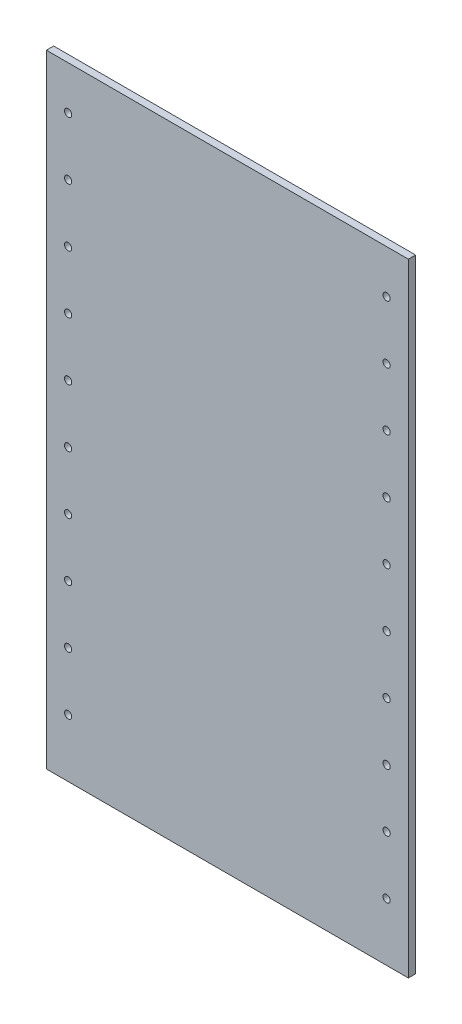
from build123d import *

# Parameters (mm, degrees)
SKETCH1_W           = 158.76
SKETCH1_H           = 273.05
SKETCH1_R           = 1.5875
BOSS_EXTRUDE1_DEPTH = 3.175


with BuildPart() as part:
    # Sketch1 → Boss-Extrude1 (new body)
    with BuildSketch(Plane.XY):
        with Locations((79.38, -136.525)):
            Rectangle(SKETCH1_W, SKETCH1_H)
        with Locations((9.53, -19.05)):
            Circle(SKETCH1_R, mode=Mode.SUBTRACT)
        with Locations((149.23, -19.05)):
            Circle(SKETCH1_R, mode=Mode.SUBTRACT)
        with Locations((149.23, -44.45)):
            Circle(SKETCH1_R, mode=Mode.SUBTRACT)
        with Locations((149.23, -69.85)):
            Circle(SKETCH1_R, mode=Mode.SUBTRACT)
        with Locations((149.23, -95.25)):
            Circle(SKETCH1_R, mode=Mode.SUBTRACT)
        with Locations((149.23, -120.65)):
            Circle(SKETCH1_R, mode=Mode.SUBTRACT)
        with Locations((149.23, -146.05)):
            Circle(SKETCH1_R, mode=Mode.SUBTRACT)
        with Locations((149.23, -171.45)):
            Circle(SKETCH1_R, mode=Mode.SUBTRACT)
        with Locations((149.23, -196.85)):
            Circle(SKETCH1_R, mode=Mode.SUBTRACT)
        with Locations((149.23, -222.25)):
            Circle(SKETCH1_R, mode=Mode.SUBTRACT)
        with Locations((149.23, -247.65)):
            Circle(SKETCH1_R, mode=Mode.SUBTRACT)
        with Locations((9.53, -44.45)):
            Circle(SKETCH1_R, mode=Mode.SUBTRACT)
        with Locations((9.53, -69.85)):
            Circle(SKETCH1_R, mode=Mode.SUBTRACT)
        with Locations((9.53, -95.25)):
            Circle(SKETCH1_R, mode=Mode.SUBTRACT)
        with Locations((9.53, -120.65)):
            Circle(SKETCH1_R, mode=Mode.SUBTRACT)
        with Locations((9.53, -146.05)):
            Circle(SKETCH1_R, mode=Mode.SUBTRACT)
        with Locations((9.53, -171.45)):
            Circle(SKETCH1_R, mode=Mode.SUBTRACT)
        with Locations((9.53, -196.85)):
            Circle(SKETCH1_R, mode=Mode.SUBTRACT)
        with Locations((9.53, -222.25)):
            Circle(SKETCH1_R, mode=Mode.SUBTRACT)
        with Locations((9.53, -247.65)):
            Circle(SKETCH1_R, mode=Mode.SUBTRACT)
    extrude(amount=BOSS_EXTRUDE1_DEPTH)


solid = part.part
